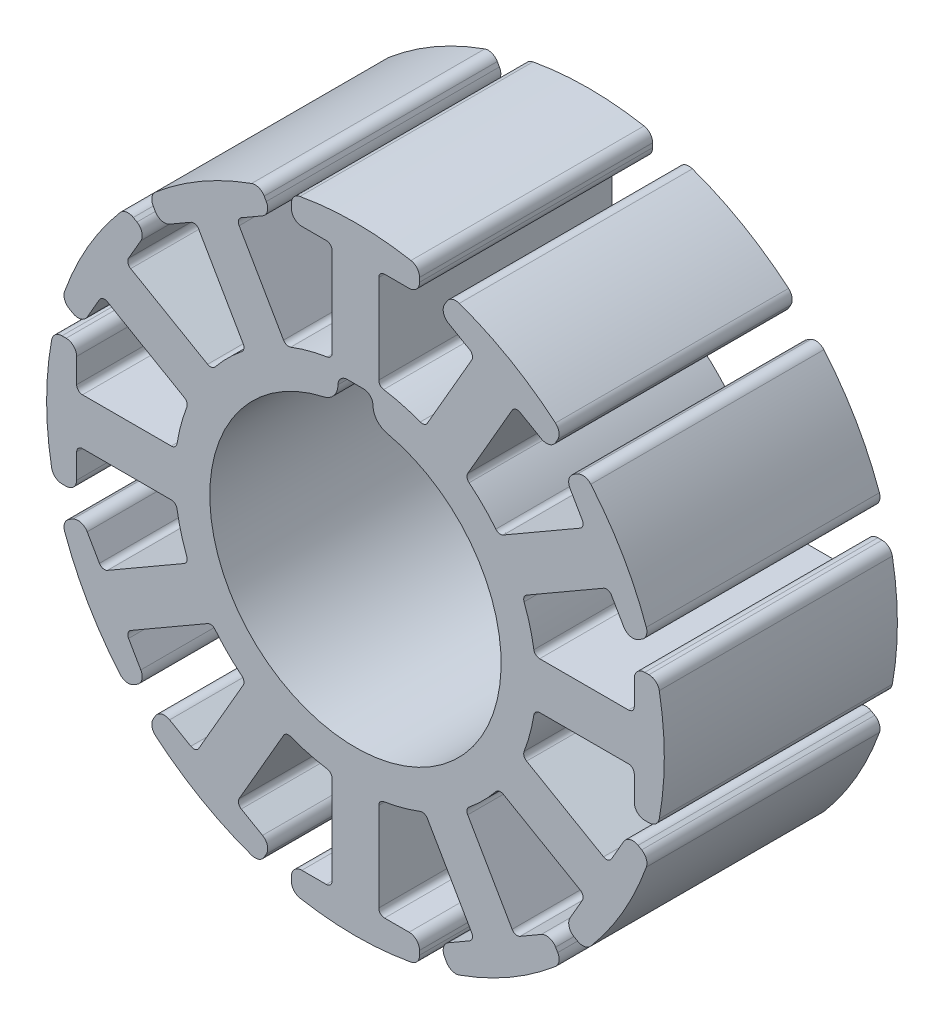
from build123d import *

# Parameters (mm, degrees)
SKETCH_1_R          = 12.5
EXTRUDE_1_DEPTH     = 20
FILLET_1_R          = 0.9
FILLET_2_R          = 0.9
FILLET_3_R          = 0.9
FILLET_4_R          = 0.9
FILLET_5_R          = 0.5
FILLET_6_R          = 0.5
SKETCH_3_W          = 3
SKETCH_3_H          = 4
CUT_EXTRUDE_1_DEPTH = 43.479406776
FILLET_7_R          = 1.55
FILLET_8_R          = 0.8


with BuildPart() as part:
    # ｽｹｯﾁ1 → ﾎﾞｽ - 押し出し1 (new body)
    with BuildSketch(Plane.XY):
        with BuildLine():
            Line((-2, 23.922962794), (-2, 15.370426149))
            ThreePointArc((-2, 15.370426149), (-4.011695199, 14.971850307), (-5.953162267, 14.311179512))
            Line((-5.953162267, 14.311179512), (-10.229430589, 21.717893513))
            Line((-10.229430589, 21.717893513), (-7.198341676, 23.467893513))
            Line((-7.198341676, 23.467893513), (-8.198341676, 25.199944321))
            ThreePointArc((-8.198341676, 25.199944321), (-13.25, 22.9496732), (-17.724621118, 19.699944321))
            Line((-17.724621118, 19.699944321), (-16.724621118, 17.967893513))
            Line((-16.724621118, 17.967893513), (-13.693532204, 19.717893513))
            Line((-13.693532204, 19.717893513), (-9.417263882, 12.311179512))
            ThreePointArc((-9.417263882, 12.311179512), (-10.960155108, 10.960155108), (-12.311179512, 9.417263882))
            Line((-12.311179512, 9.417263882), (-19.717893513, 13.693532204))
            Line((-19.717893513, 13.693532204), (-17.967893513, 16.724621118))
            Line((-17.967893513, 16.724621118), (-19.699944321, 17.724621118))
            ThreePointArc((-19.699944321, 17.724621118), (-22.9496732, 13.25), (-25.199944321, 8.198341676))
            Line((-25.199944321, 8.198341676), (-23.467893513, 7.198341676))
            Line((-23.467893513, 7.198341676), (-21.717893513, 10.229430589))
            Line((-21.717893513, 10.229430589), (-14.311179512, 5.953162267))
            ThreePointArc((-14.311179512, 5.953162267), (-14.971850307, 4.011695199), (-15.370426149, 2))
            Line((-15.370426149, 2), (-23.922962794, 2))
            Line((-23.922962794, 2), (-23.922962794, 5.5))
            Line((-23.922962794, 5.5), (-25.922962794, 5.5))
            ThreePointArc((-25.922962794, 5.5), (-26.5, 0), (-25.922962794, -5.5))
            Line((-25.922962794, -5.5), (-23.922962794, -5.5))
            Line((-23.922962794, -5.5), (-23.922962794, -2))
            Line((-23.922962794, -2), (-15.370426149, -2))
            ThreePointArc((-15.370426149, -2), (-14.971850307, -4.011695199), (-14.311179512, -5.953162267))
            Line((-14.311179512, -5.953162267), (-21.717893513, -10.229430589))
            Line((-21.717893513, -10.229430589), (-23.467893513, -7.198341676))
            Line((-23.467893513, -7.198341676), (-25.199944321, -8.198341676))
            ThreePointArc((-25.199944321, -8.198341676), (-22.9496732, -13.25), (-19.699944321, -17.724621118))
            Line((-19.699944321, -17.724621118), (-17.967893513, -16.724621118))
            Line((-17.967893513, -16.724621118), (-19.717893513, -13.693532204))
            Line((-19.717893513, -13.693532204), (-12.311179512, -9.417263882))
            ThreePointArc((-12.311179512, -9.417263882), (-10.960155108, -10.960155108), (-9.417263882, -12.311179512))
            Line((-9.417263882, -12.311179512), (-13.693532204, -19.717893513))
            Line((-13.693532204, -19.717893513), (-16.724621118, -17.967893513))
            Line((-16.724621118, -17.967893513), (-17.724621118, -19.699944321))
            ThreePointArc((-17.724621118, -19.699944321), (-13.25, -22.9496732), (-8.198341676, -25.199944321))
            Line((-8.198341676, -25.199944321), (-7.198341676, -23.467893513))
            Line((-7.198341676, -23.467893513), (-10.229430589, -21.717893513))
            Line((-10.229430589, -21.717893513), (-5.953162267, -14.311179512))
            ThreePointArc((-5.953162267, -14.311179512), (-4.011695199, -14.971850307), (-2, -15.370426149))
            Line((-2, -15.370426149), (-2, -23.922962794))
            Line((-2, -23.922962794), (-5.5, -23.922962794))
            Line((-5.5, -23.922962794), (-5.5, -25.922962794))
            ThreePointArc((-5.5, -25.922962794), (0, -26.5), (5.5, -25.922962794))
            Line((5.5, -25.922962794), (5.5, -23.922962794))
            Line((5.5, -23.922962794), (2, -23.922962794))
            Line((2, -23.922962794), (2, -15.370426149))
            ThreePointArc((2, -15.370426149), (4.011695199, -14.971850307), (5.953162267, -14.311179512))
            Line((5.953162267, -14.311179512), (10.229430589, -21.717893513))
            Line((10.229430589, -21.717893513), (7.198341676, -23.467893513))
            Line((7.198341676, -23.467893513), (8.198341676, -25.199944321))
            ThreePointArc((8.198341676, -25.199944321), (13.25, -22.9496732), (17.724621118, -19.699944321))
            Line((17.724621118, -19.699944321), (16.724621118, -17.967893513))
            Line((16.724621118, -17.967893513), (13.693532204, -19.717893513))
            Line((13.693532204, -19.717893513), (9.417263882, -12.311179512))
            ThreePointArc((9.417263882, -12.311179512), (10.960155108, -10.960155108), (12.311179512, -9.417263882))
            Line((12.311179512, -9.417263882), (19.717893513, -13.693532204))
            Line((19.717893513, -13.693532204), (17.967893513, -16.724621118))
            Line((17.967893513, -16.724621118), (19.699944321, -17.724621118))
            ThreePointArc((19.699944321, -17.724621118), (22.9496732, -13.25), (25.199944321, -8.198341676))
            Line((25.199944321, -8.198341676), (23.467893513, -7.198341676))
            Line((23.467893513, -7.198341676), (21.717893513, -10.229430589))
            Line((21.717893513, -10.229430589), (14.311179512, -5.953162267))
            ThreePointArc((14.311179512, -5.953162267), (14.971850307, -4.011695199), (15.370426149, -2))
            Line((15.370426149, -2), (23.922962794, -2))
            Line((23.922962794, -2), (23.922962794, -5.5))
            Line((23.922962794, -5.5), (25.922962794, -5.5))
            ThreePointArc((25.922962794, -5.5), (26.5, 0), (25.922962794, 5.5))
            Line((25.922962794, 5.5), (23.922962794, 5.5))
            Line((23.922962794, 5.5), (23.922962794, 2))
            Line((23.922962794, 2), (15.370426149, 2))
            ThreePointArc((15.370426149, 2), (14.971850307, 4.011695199), (14.311179512, 5.953162267))
            Line((14.311179512, 5.953162267), (21.717893513, 10.229430589))
            Line((21.717893513, 10.229430589), (23.467893513, 7.198341676))
            Line((23.467893513, 7.198341676), (25.199944321, 8.198341676))
            ThreePointArc((25.199944321, 8.198341676), (22.9496732, 13.25), (19.699944321, 17.724621118))
            Line((19.699944321, 17.724621118), (17.967893513, 16.724621118))
            Line((17.967893513, 16.724621118), (19.717893513, 13.693532204))
            Line((19.717893513, 13.693532204), (12.311179512, 9.417263882))
            ThreePointArc((12.311179512, 9.417263882), (10.960155108, 10.960155108), (9.417263882, 12.311179512))
            Line((9.417263882, 12.311179512), (13.693532204, 19.717893513))
            Line((13.693532204, 19.717893513), (16.724621118, 17.967893513))
            Line((16.724621118, 17.967893513), (17.724621118, 19.699944321))
            ThreePointArc((17.724621118, 19.699944321), (13.25, 22.9496732), (8.198341676, 25.199944321))
            Line((8.198341676, 25.199944321), (7.198341676, 23.467893513))
            Line((7.198341676, 23.467893513), (10.229430589, 21.717893513))
            Line((10.229430589, 21.717893513), (5.953162267, 14.311179512))
            ThreePointArc((5.953162267, 14.311179512), (4.011695199, 14.971850307), (2, 15.370426149))
            Line((2, 15.370426149), (2, 23.922962794))
            Line((2, 23.922962794), (5.5, 23.922962794))
            Line((5.5, 23.922962794), (5.5, 25.922962794))
            ThreePointArc((5.5, 25.922962794), (0, 26.5), (-5.5, 25.922962794))
            Line((-5.5, 25.922962794), (-5.5, 23.922962794))
            Line((-5.5, 23.922962794), (-2, 23.922962794))
        make_face()
        Circle(SKETCH_1_R, mode=Mode.SUBTRACT)
    extrude(amount=EXTRUDE_1_DEPTH)

    # ﾌｨﾚｯﾄ1
    fillet_1_edges = [part.edges().sort_by_distance(p)[0] for p in [
        (-16.724621118, 17.967893513, 10),
        (-17.724621118, 19.699944321, 10),
        (-8.198341676, 25.199944321, 10),
        (-7.198341676, 23.467893513, 10),
    ]]
    fillet(fillet_1_edges, radius=FILLET_1_R)

    # ﾌｨﾚｯﾄ2
    fillet_2_edges = [part.edges().sort_by_distance(p)[0] for p in [
        (23.467893513, 7.198341676, 10),
        (16.724621118, 17.967893513, 10),
        (17.967893513, 16.724621118, 10),
        (25.199944321, 8.198341676, 10),
        (5.5, 23.922962794, 10),
        (19.699944321, 17.724621118, 10),
        (17.724621118, 19.699944321, 10),
        (7.198341676, 23.467893513, 10),
        (8.198341676, 25.199944321, 10),
        (5.5, 25.922962794, 10),
        (-5.5, 23.922962794, 10),
        (-5.5, 25.922962794, 10),
    ]]
    fillet(fillet_2_edges, radius=FILLET_2_R)

    # ﾌｨﾚｯﾄ3
    fillet_3_edges = [part.edges().sort_by_distance(p)[0] for p in [
        (19.699944321, -17.724621118, 10),
        (17.967893513, -16.724621118, 10),
        (25.199944321, -8.198341676, 10),
        (23.467893513, -7.198341676, 10),
        (23.922962794, 5.5, 10),
        (23.922962794, -5.5, 10),
        (25.922962794, -5.5, 10),
        (25.922962794, 5.5, 10),
    ]]
    fillet(fillet_3_edges, radius=FILLET_3_R)

    # ﾌｨﾚｯﾄ4
    fillet_4_edges = [part.edges().sort_by_distance(p)[0] for p in [
        (-19.699944321, 17.724621118, 10),
        (-17.967893513, 16.724621118, 10),
        (-25.199944321, 8.198341676, 10),
        (-23.467893513, 7.198341676, 10),
        (-23.922962794, 5.5, 10),
        (-25.922962794, 5.5, 10),
        (-23.922962794, -5.5, 10),
        (-25.922962794, -5.5, 10),
        (-23.467893513, -7.198341676, 10),
        (-25.199944321, -8.198341676, 10),
        (-19.699944321, -17.724621118, 10),
        (-17.967893513, -16.724621118, 10),
        (-16.724621118, -17.967893513, 10),
        (-17.724621118, -19.699944321, 10),
        (-8.198341676, -25.199944321, 10),
        (-7.198341676, -23.467893513, 10),
        (-5.5, -23.922962794, 10),
        (-5.5, -25.922962794, 10),
        (5.5, -23.922962794, 10),
        (5.5, -25.922962794, 10),
        (8.198341676, -25.199944321, 10),
        (7.198341676, -23.467893513, 10),
        (17.724621118, -19.699944321, 10),
        (16.724621118, -17.967893513, 10),
    ]]
    fillet(fillet_4_edges, radius=FILLET_4_R)

    # ﾌｨﾚｯﾄ5
    fillet_5_edges = [part.edges().sort_by_distance(p)[0] for p in [
        (-21.717893513, -10.229430589, 10),
        (-14.311179512, -5.953162267, 10),
        (-19.717893513, -13.693532204, 10),
        (-12.311179512, -9.417263882, 10),
        (-13.693532204, -19.717893513, 10),
        (-9.417263882, -12.311179512, 10),
        (-10.229430589, -21.717893513, 10),
        (-5.953162267, -14.311179512, 10),
        (-2, -23.922962794, 10),
        (-2, -15.370426149, 10),
        (2, -23.922962794, 10),
        (2, -15.370426149, 10),
        (5.953162267, -14.311179512, 10),
        (10.229430589, -21.717893513, 10),
        (13.693532204, -19.717893513, 10),
        (9.417263882, -12.311179512, 10),
        (19.717893513, -13.693532204, 10),
        (12.311179512, -9.417263882, 10),
        (21.717893513, -10.229430589, 10),
        (14.311179512, -5.953162267, 10),
        (15.370426149, -2, 10),
        (23.922962794, -2, 10),
        (23.922962794, 2, 10),
        (15.370426149, 2, 10),
        (14.311179512, 5.953162267, 10),
        (21.717893513, 10.229430589, 10),
    ]]
    fillet(fillet_5_edges, radius=FILLET_5_R)

    # ﾌｨﾚｯﾄ6
    fillet_6_edges = [part.edges().sort_by_distance(p)[0] for p in [
        (19.717893513, 13.693532204, 10),
        (12.311179512, 9.417263882, 10),
        (9.417263882, 12.311179512, 10),
        (13.693532204, 19.717893513, 10),
        (10.229430589, 21.717893513, 10),
        (5.953162267, 14.311179512, 10),
        (-2, 15.370426149, 10),
        (-2, 23.922962794, 10),
        (2, 23.922962794, 10),
        (-10.229430589, 21.717893513, 10),
        (-9.417263882, 12.311179512, 10),
        (-19.717893513, 13.693532204, 10),
        (-13.693532204, 19.717893513, 10),
        (-21.717893513, 10.229430589, 10),
        (-14.311179512, 5.953162267, 10),
        (2, 15.370426149, 10),
        (-5.953162267, 14.311179512, 10),
        (-12.311179512, 9.417263882, 10),
        (-23.922962794, 2, 10),
        (-15.370426149, 2, 10),
        (-23.922962794, -2, 10),
        (-15.370426149, -2, 10),
    ]]
    fillet(fillet_6_edges, radius=FILLET_6_R)

    # ｽｹｯﾁ3 → ｶｯﾄ - 押し出し1 (cut, through all)
    with BuildSketch(Plane.XY.offset(20)):
        with Locations((0, 12.5)):
            Rectangle(SKETCH_3_W, SKETCH_3_H)
    extrude(amount=-CUT_EXTRUDE_1_DEPTH, mode=Mode.SUBTRACT)

    # ﾌｨﾚｯﾄ7
    fillet_7_edges = [part.edges().sort_by_distance(p)[0] for p in [
        (1.5, 12.409673646, 10),
        (-1.5, 12.409673646, 10),
    ]]
    fillet(fillet_7_edges, radius=FILLET_7_R)

    # ﾌｨﾚｯﾄ8
    fillet_8_edges = [part.edges().sort_by_distance(p)[0] for p in [
        (1.5, 14.5, 10),
        (-1.5, 14.5, 10),
    ]]
    fillet(fillet_8_edges, radius=FILLET_8_R)


solid = part.part
